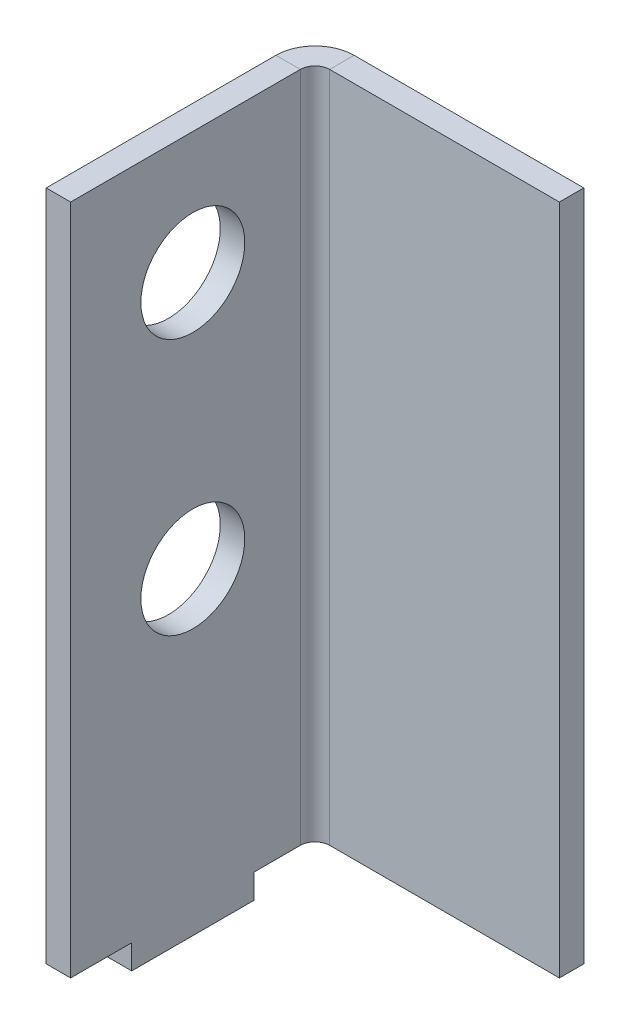
from build123d import *

# Parameters (mm, degrees)
SKETCH_1_W                       = 2
SKETCH_1_H                       = 55
SM_BASE_FLANGE_1_DEPTH           = 20
SM_EDGE_FLANGE_1_STRIP_W         = 10.4
SM_EDGE_FLANGE_1_STRIP_H         = 2
SM_EDGE_FLANGE_1_STRIP_CUT_DEPTH = 55
SM_EDGE_FLANGE_1_DEPTH           = 55
SKETCH_6_W                       = 2
SKETCH_6_H                       = 10
EXTRUDE_1_DEPTH                  = 2
SKETCH_8_R                       = 4.25
CUT_EXTRUDE_2_DEPTH              = 5


# Sheet-metal steps are written as plain solids
with BuildPart() as part:
    # Sketch 1 → Базовая кромка1 (new body)
    with BuildSketch(Plane.XY):
        with Locations((-34.970714213, 24.511351052)):
            Rectangle(SKETCH_1_W, SKETCH_1_H)
    extrude(amount=SM_BASE_FLANGE_1_DEPTH)

    # Ребро-кромка1 strip (across the edge) → Ребро-кромка1 strip cut (cut)
    with BuildSketch(Plane(origin=(-33.970714213, -2.988648948, 0), x_dir=(0, 0, 1), z_dir=(0, 1, 0))):
        with Locations((-4, -1)):
            Rectangle(SM_EDGE_FLANGE_1_STRIP_W, SM_EDGE_FLANGE_1_STRIP_H)
    extrude(amount=SM_EDGE_FLANGE_1_STRIP_CUT_DEPTH, mode=Mode.SUBTRACT)

    # Ребро-кромка1 section (across the edge) → Ребро-кромка1 (add)
    with BuildSketch(Plane(origin=(-33.970714213, -2.988648948, 0), x_dir=(0, 0, 1), z_dir=(0, 1, 0))):
        with BuildLine():
            Line((-2, 1.2), (-2, 20))
            Line((-2, 20), (0, 20))
            Line((0, 20), (0, 1.2))
            ThreePointArc((0, 1.2), (0.351471863, 0.351471863), (1.2, 0))
            Line((1.2, 0), (1.2, -2))
            ThreePointArc((1.2, -2), (-1.0627417, -1.0627417), (-2, 1.2))
        make_face()
    extrude(amount=SM_EDGE_FLANGE_1_DEPTH)

    # Эскиз6 → Бобышка-Вытянуть1 (add)
    with BuildSketch(Plane.XZ.offset(2.988648948)):
        with Locations((-34.970714213, 10)):
            Rectangle(SKETCH_6_W, SKETCH_6_H)
    extrude(amount=EXTRUDE_1_DEPTH)

    # Эскиз8 → Вырез-Вытянуть2 (cut)
    with BuildSketch(Plane.ZY.offset(35.970714213)):
        with Locations((10, 42.011351052)):
            Circle(SKETCH_8_R)
        with Locations((10, 21.011351052)):
            Circle(SKETCH_8_R)
    extrude(amount=-CUT_EXTRUDE_2_DEPTH, mode=Mode.SUBTRACT)


solid = part.part
